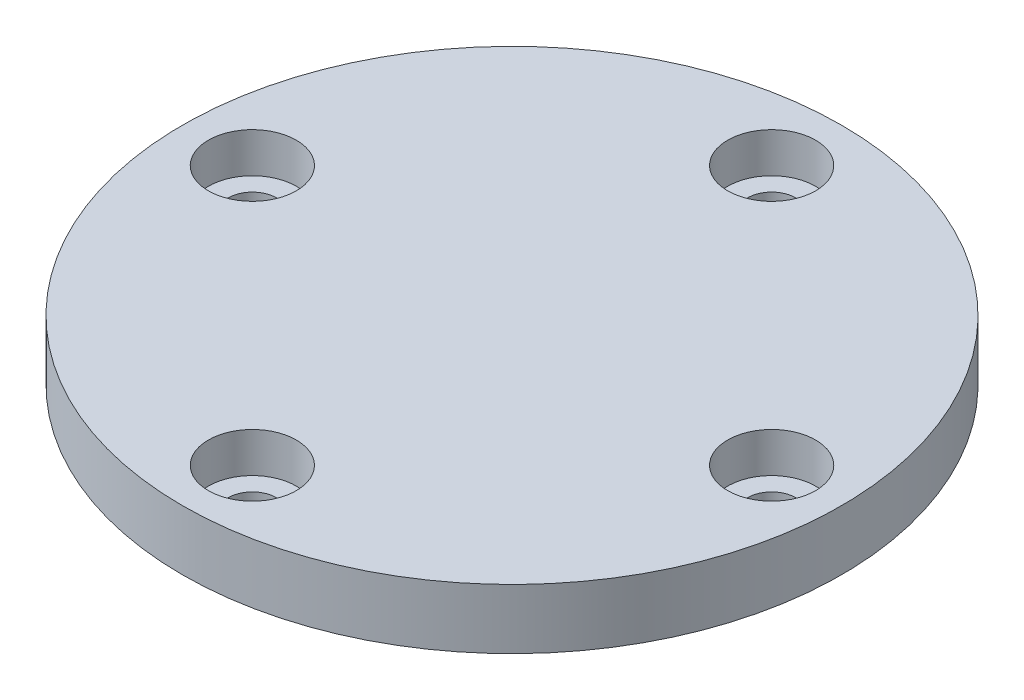
from build123d import *

# Parameters (mm, degrees)
SKETCH1_R                      = 16.5
BOSS_EXTRUDE1_DEPTH            = 3
CBORE_FOR_M2_SHCS1_D           = 2.4
CBORE_FOR_M2_SHCS1_CBORE_D     = 4.4
CBORE_FOR_M2_SHCS1_CBORE_DEPTH = 2
CIRPATTERN1_COUNT              = 4
SKETCH8_R                      = 9
BOSS_EXTRUDE2_DEPTH            = 2


with BuildPart() as part:
    # Sketch1 → Boss-Extrude1 (new body)
    with BuildSketch(Plane(origin=(0, 0, 0), x_dir=(1, 0, 0), z_dir=(0, 1, 0))):
        Circle(SKETCH1_R)
    extrude(amount=BOSS_EXTRUDE1_DEPTH)

    # CBORE for M2 SHCS1 (through all)
    with Locations(Plane(origin=(0, 3, 0), x_dir=(1, 0, 0), z_dir=(0, 1, 0))):
        with Locations((13, 0)):
            cbore_for_m2_shcs1 = CounterBoreHole(CBORE_FOR_M2_SHCS1_D / 2, CBORE_FOR_M2_SHCS1_CBORE_D / 2, CBORE_FOR_M2_SHCS1_CBORE_DEPTH)

    # CirPattern1: CBORE for M2 SHCS1 ×4 about axis
    cirpattern1_axis = Axis((0, 3, 0), (0, 1, 0))
    for i in range(1, CIRPATTERN1_COUNT):
        add(cbore_for_m2_shcs1.rotate(cirpattern1_axis, i * 360 / CIRPATTERN1_COUNT), mode=Mode.SUBTRACT)

    # Sketch8 → Boss-Extrude2 (add)
    with BuildSketch(Plane.XZ):
        Circle(SKETCH8_R)
    extrude(amount=BOSS_EXTRUDE2_DEPTH)


solid = part.part
